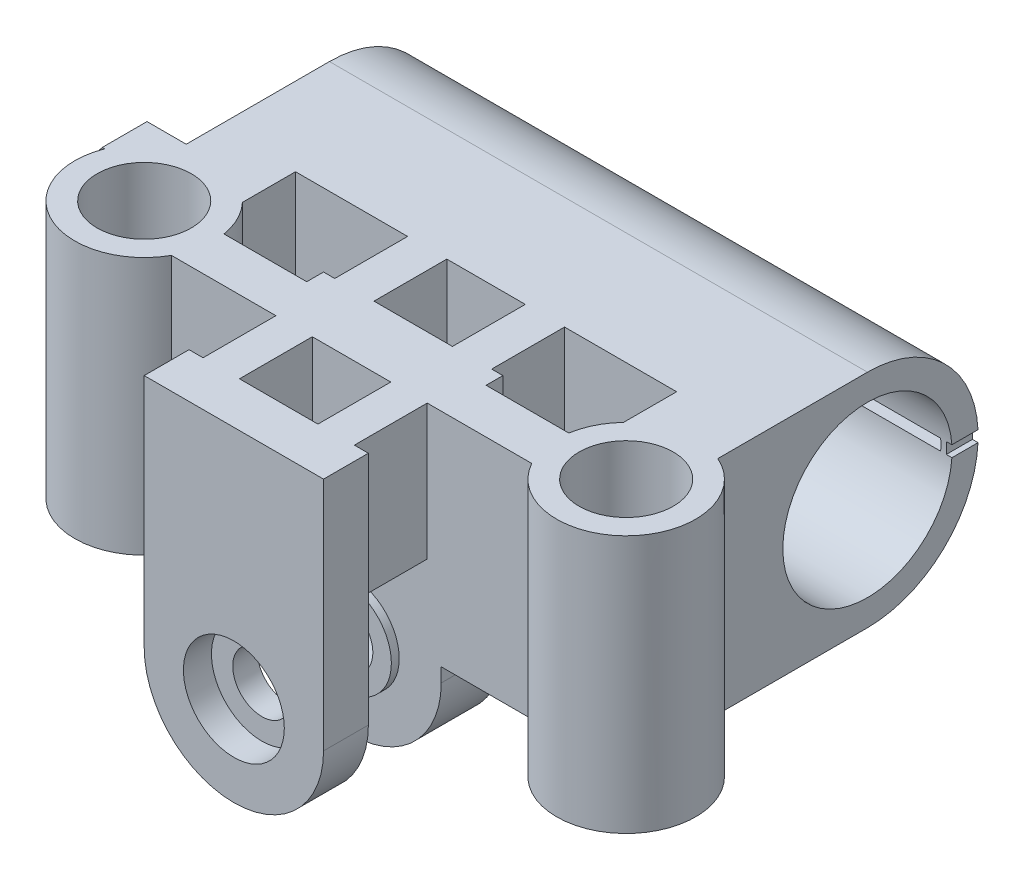
from build123d import *
from build123d.topology import SkipClean

# Parameters (mm, degrees)
BOSS_EXTRUDE1_DEPTH      = 19.75
FILLET1_RADIUS           = 9.875
FILLET1_LENGTH           = 48
SKETCH2_R                = 7.55
CUT_EXTRUDE1_DEPTH       = 70.718810231
BOSS_EXTRUDE2_START      = -23
SKETCH3_R                = 6.2
BOSS_EXTRUDE2_DEPTH      = 23
SKETCH4_R                = 4.2
CUT_EXTRUDE2_DEPTH       = 56.624185387
SKETCH5_W                = 7
SKETCH5_H                = 6.5
CUT_EXTRUDE3_DEPTH       = 56.624185387
BOSS_EXTRUDE3_DEPTH      = 4
CUT_EXTRUDE4_START       = -13.5
CUT_EXTRUDE4_OUTLINE_W   = 6.5
CUT_EXTRUDE4_OUTLINE_H   = 7.7
CUT_EXTRUDE4_DEPTH       = 13.5
BOSS_EXTRUDE4_DEPTH      = 5.5
SKETCH9_W                = 6.5
SKETCH9_H                = 7.7
CUT_EXTRUDE5_DEPTH       = 14
BOSS_EXTRUDE5_DEPTH      = 4
BOSS_EXTRUDE6_REACH      = 53.302
SKETCH11_R               = 4.25
CUT_EXTRUDE7_DEPTH       = 55.36094646
CUT_EXTRUDE7_DEPTH_BACK  = 5
SKETCH13_W               = 8.5
SKETCH13_H               = 5.1
CUT_EXTRUDE8_DEPTH       = 2.5
CUT_EXTRUDE6_REACH       = 56.361
SKETCH12_R               = 2.6
BOSS_EXTRUDE7_REACH      = 45.123
BOSS_EXTRUDE7_END_RADIUS = 9.875
SKETCH17_W               = 2.341574484
SKETCH17_H               = 1
CUT_EXTRUDE9_DEPTH       = 70.718810231
BOSS_EXTRUDE8_START      = -1
BOSS_EXTRUDE8_DEPTH      = 0.5
LPATTERN1_COUNT          = 7
LPATTERN1_PITCH          = 7.75
SKETCH19_R               = 4.5
CUT_EXTRUDE10_DEPTH      = 2.5
SKETCH20_W               = 4
SKETCH20_H               = 15.5
BOSS_EXTRUDE9_DEPTH      = 6.45
CUT_EXTRUDE11_REACH      = 44.782
SKETCH22_R               = 4.2
CUT_EXTRUDE12_DEPTH      = 60.71568052


# Read off the part's stored shape, not the designer's step: Cut-Extrude4
with BuildPart() as part:
    # Sketch1 → Boss-Extrude1 (new body)
    with BuildSketch(Plane(origin=(0, 0, 0), x_dir=(1, 0, 0), z_dir=(0, 1, 0))):
        with BuildLine():
            Line((16.074136013, -31.9), (6.75, -31.9))
            Line((6.75, -31.9), (6.75, -38.4))
            Line((6.75, -38.4), (8, -38.4))
            Line((8, -38.4), (8, -42.4))
            Line((8, -42.4), (-8, -42.4))
            Line((-8, -42.4), (-8, -38.4))
            Line((-8, -38.4), (-6.75, -38.4))
            Line((-6.75, -38.4), (-6.75, -31.9))
            Line((-6.75, -31.9), (-16.074136013, -31.9))
            ThreePointArc((-16.074136013, -31.9), (-26.076909961, -33.082331313), (-24, -23.226376819))
            Line((-24, -23.226376819), (-24, 0))
            Line((-24, 0), (24, 0))
            Line((24, 0), (24, -23.226376819))
            ThreePointArc((24, -23.226376819), (26.076909961, -33.082331313), (16.074136013, -31.9))
        make_face()
    extrude(amount=BOSS_EXTRUDE1_DEPTH)

    # Fillet1: full round fillet: the end face becomes a half cylinder, R = half its width
    fillet1_face = Plane((0, 9.875, 0), x_dir=(1, 0, 0), z_dir=(0, 0, -1))  # on the end face: x along it, z out of the body
    fillet1_slab = fillet1_face.offset(-FILLET1_RADIUS / 2) * Box(FILLET1_LENGTH, 2 * FILLET1_RADIUS, FILLET1_RADIUS, mode=Mode.PRIVATE)  # the body's end, R deep
    fillet1_round = Plane((0, 9.875, 9.875), x_dir=(0, 0, -1), z_dir=(1, 0, 0)) * Cylinder(FILLET1_RADIUS, FILLET1_LENGTH, mode=Mode.PRIVATE)  # its axis R under the face
    add(fillet1_slab - fillet1_round, mode=Mode.SUBTRACT)

    # Sketch2 → Cut-Extrude1 (cut, through all)
    with BuildSketch(Plane(origin=(24, 0, 0), x_dir=(0, 0, -1), z_dir=(1, 0, 0))):
        with Locations((-9.875, 9.875)):
            Circle(SKETCH2_R)
    extrude(amount=-CUT_EXTRUDE1_DEPTH, mode=Mode.SUBTRACT)

    # Sketch3 → Boss-Extrude2 (add)
    with SkipClean():  # the faces are left unmerged after this step: merging them gives an invalid solid
        with BuildSketch(Plane(origin=(0, 19.75, 0), x_dir=(1, 0, 0), z_dir=(0, 1, 0)).offset(BOSS_EXTRUDE2_START)):
            with Locations(Location((21.5, -28.9, 0), (0, 0, 66.220005269))):
                Circle(SKETCH3_R)
            with Locations(Location((-21.5, -28.9, 0), (0, 0, 113.779994731))):
                Circle(SKETCH3_R)
        extrude(amount=BOSS_EXTRUDE2_DEPTH)

    # Sketch4 → Cut-Extrude2 (cut, through all)
    with SkipClean():  # the faces are left unmerged after this step: merging them gives an invalid solid
        with BuildSketch(Plane(origin=(0, 19.75, 0), x_dir=(1, 0, 0), z_dir=(0, 1, 0))):
            with Locations(Location((-21.5, -28.9, 0), (0, 0, 270))):
                Circle(SKETCH4_R)
            with Locations(Location((21.5, -28.9, 0), (0, 0, 270))):
                Circle(SKETCH4_R)
        extrude(amount=-CUT_EXTRUDE2_DEPTH, mode=Mode.SUBTRACT)

    # Sketch5 → Cut-Extrude3 (cut, through all)
    with SkipClean():  # the faces are left unmerged after this step: merging them gives an invalid solid
        with BuildSketch(Plane(origin=(0, 19.75, 0), x_dir=(1, 0, 0), z_dir=(0, 1, 0))):
            with Locations((0, -23.15)):
                Rectangle(SKETCH5_W, SKETCH5_H)
            with Locations((0, -35.15)):
                Rectangle(SKETCH5_W, SKETCH5_H)
            with BuildLine():
                Line((17, -19.9), (7, -19.9))
                Line((7, -19.9), (7, -26.4))
                Line((7, -26.4), (8, -26.4))
                Line((8, -26.4), (8, -27.9))
                Line((8, -27.9), (15.381176584, -27.9))
                ThreePointArc((15.381176584, -27.9), (15.945284357, -26.145887779), (17, -24.635026378))
                Line((17, -24.635026378), (17, -19.9))
            make_face()
            with BuildLine():
                Line((-7, -19.9), (-17, -19.9))
                Line((-17, -19.9), (-17, -24.635026378))
                ThreePointArc((-17, -24.635026378), (-15.945284357, -26.145887779), (-15.381176584, -27.9))
                Line((-15.381176584, -27.9), (-8, -27.9))
                Line((-8, -27.9), (-8, -26.4))
                Line((-8, -26.4), (-7, -26.4))
                Line((-7, -26.4), (-7, -19.9))
            make_face()
        extrude(amount=-CUT_EXTRUDE3_DEPTH, mode=Mode.SUBTRACT)

    # Sketch6 → Boss-Extrude3 (add)
    with SkipClean():  # the faces are left unmerged after this step: merging them gives an invalid solid
        with BuildSketch(Plane.XY.offset(42.4)):
            with BuildLine():
                Line((-8, 0), (-8, -1.25))
                ThreePointArc((-8, -1.25), (0, -9.25), (8, -1.25))
                Line((8, -1.25), (8, 0))
                Line((8, 0), (-8, 0))
            make_face()
        extrude(amount=-BOSS_EXTRUDE3_DEPTH)

    # Cut-Extrude4 outline → Cut-Extrude4 (cut)
    with SkipClean():  # the faces are left unmerged after this step: merging them gives an invalid solid
        with BuildSketch(Plane(origin=(6.75, 0, 0), x_dir=(0, 0, -1), z_dir=(1, 0, 0)).offset(CUT_EXTRUDE4_START)):
            with Locations((-35.15, 3.85)):
                Rectangle(CUT_EXTRUDE4_OUTLINE_W, CUT_EXTRUDE4_OUTLINE_H)
        extrude(amount=CUT_EXTRUDE4_DEPTH, mode=Mode.SUBTRACT)
    add(part.part.scale(1), mode=Mode.REPLACE)  # the faces are merged on a copy

    # Sketch8 → Boss-Extrude4 (add)
    with BuildSketch(Plane.XY.offset(31.9)):
        with BuildLine():
            Line((-8, -1.25), (-8, 0))
            Line((-8, 0), (8, 0))
            Line((8, 0), (8, -1.25))
            ThreePointArc((8, -1.25), (0, -9.25), (-8, -1.25))
        make_face()
    extrude(amount=-BOSS_EXTRUDE4_DEPTH)

    # Sketch9 → Cut-Extrude5 (cut)
    with BuildSketch(Plane(origin=(7, 0, 0), x_dir=(0, 0, -1), z_dir=(1, 0, 0))):
        with Locations((-23.15, 3.85)):
            Rectangle(SKETCH9_W, SKETCH9_H)
    extrude(amount=-CUT_EXTRUDE5_DEPTH, mode=Mode.SUBTRACT)

    # Sketch10 → Boss-Extrude5 (add)
    with BuildSketch(Plane.XY.offset(19.9)):
        with BuildLine():
            Line((-8, -1.25), (-8, 0))
            Line((-8, 0), (8, 0))
            Line((8, 0), (8, -1.25))
            ThreePointArc((8, -1.25), (0, -9.25), (-8, -1.25))
        make_face()
    extrude(amount=-BOSS_EXTRUDE5_DEPTH)

    # Boss-Extrude6: up to this face of the body (flat: up to its plane)
    boss_extrude6_end = Plane(part.part.faces().sort_by_distance((0, 13.725, 19.9))[0])
    # Sketch11 → Boss-Extrude6 (add, up to the picked face)
    with BuildSketch(Plane(origin=(0, 0, 38.4), x_dir=(-1, 0, 0), z_dir=(0, 0, -1)), mode=Mode.PRIVATE) as boss_extrude6_sk1:
        with Locations(Location((0, -1.25, 0), (0, 0, 180))):
            Circle(SKETCH11_R)
    boss_extrude6_tool1 = split(extrude(boss_extrude6_sk1.sketch, amount=BOSS_EXTRUDE6_REACH, mode=Mode.PRIVATE), bisect_by=boss_extrude6_end, keep=Keep.BOTH, mode=Mode.PRIVATE)
    add(boss_extrude6_tool1.solids().sort_by(Axis((0, -1.25, 38.4), (0, 0, -1)))[0])

    # Sketch13 → Cut-Extrude7 (cut, two sides: drawn at the far end of the back side and taken through both)
    with BuildSketch(Plane.XZ.offset(-CUT_EXTRUDE7_DEPTH_BACK)):
        with Locations((0, 35.15)):
            Rectangle(SKETCH13_W, SKETCH13_H)
        with Locations((0, 23.15)):
            Rectangle(SKETCH13_W, SKETCH13_H)
    extrude(amount=CUT_EXTRUDE7_DEPTH + CUT_EXTRUDE7_DEPTH_BACK, mode=Mode.SUBTRACT)

    # Sketch15 → Cut-Extrude8 (cut, symmetric)
    with BuildSketch(Plane(origin=(0, 0, 0), x_dir=(0, 0, -1), z_dir=(1, 0, 0))):
        with BuildLine():
            Line((-15.9, 0), (-15.9, 2.050998466))
            ThreePointArc((-15.9, 2.050998466), (-13.05726412, 0.526801239), (-9.875, 0))
            Line((-9.875, 0), (-15.9, 0))
        make_face()
    extrude(amount=CUT_EXTRUDE8_DEPTH, both=True, mode=Mode.SUBTRACT)

    # Cut-Extrude6: up to this face of the body (flat: up to its plane)
    cut_extrude6_end = Plane(part.part.faces().sort_by_distance((0, -3.978206263, 15.9))[0])
    # Sketch12 → Cut-Extrude6 (cut, up to the picked face)
    with BuildSketch(Plane.XY.offset(42.4), mode=Mode.PRIVATE) as cut_extrude6_sk1:
        with Locations((0, -1.25)):
            Circle(SKETCH12_R)
    cut_extrude6_tool1 = split(extrude(cut_extrude6_sk1.sketch, amount=-CUT_EXTRUDE6_REACH, mode=Mode.PRIVATE), bisect_by=cut_extrude6_end, keep=Keep.BOTH, mode=Mode.PRIVATE)
    add(cut_extrude6_tool1.solids().sort_by(Axis((0, -1.25, 42.4), (0, 0, -1)))[0], mode=Mode.SUBTRACT)

    # Boss-Extrude7: up to this cylinder (the profile starts outside it)
    boss_extrude7_end = Plane(origin=(2.389901, 9.875, 9.875), z_dir=(1, 0, 0)) * Cylinder(BOSS_EXTRUDE7_END_RADIUS, 110.996, mode=Mode.PRIVATE)
    # Sketch16 → Boss-Extrude7 (add, up to the surface)
    with BuildSketch(Plane(origin=(0, 0, 15.9), x_dir=(-1, 0, 0), z_dir=(0, 0, -1)), mode=Mode.PRIVATE) as boss_extrude7_sk1:
        with BuildLine():
            Line((-2.279802623, 0), (-2.5, 0))
            Line((-2.5, 0), (-2.5, 1.800187721))
            Line((-2.5, 1.800187721), (2.5, 1.800187721))
            Line((2.5, 1.800187721), (2.5, 0))
            Line((2.5, 0), (2.279802623, 0))
            ThreePointArc((2.279802623, 0), (0, 1.35), (-2.279802623, 0))
        make_face()
    boss_extrude7_tool1 = extrude(boss_extrude7_sk1.sketch, amount=BOSS_EXTRUDE7_REACH, mode=Mode.PRIVATE) - boss_extrude7_end
    add(boss_extrude7_tool1.solids().sort_by_distance((2.389901, 0.053142, 15.9))[0])

    # Sketch17 → Cut-Extrude9 (cut, through all)
    with BuildSketch(Plane.ZY.offset(24)):
        with Locations((1.170787242, 9.875)):
            Rectangle(SKETCH17_W, SKETCH17_H)
    extrude(amount=-CUT_EXTRUDE9_DEPTH, mode=Mode.SUBTRACT)

    # Sketch18 → Boss-Extrude8 (add)
    with BuildSketch(Plane.ZY.offset(24).offset(BOSS_EXTRUDE8_START)):
        with BuildLine():
            Line((0.012666351, 10.375), (2.341574484, 10.375))
            ThreePointArc((2.341574484, 10.375), (2.325, 9.875), (2.341574484, 9.375))
            Line((2.341574484, 9.375), (0.012666351, 9.375))
            ThreePointArc((0.012666351, 9.375), (0, 9.875), (0.012666351, 10.375))
        make_face()
    boss_extrude8 = extrude(amount=BOSS_EXTRUDE8_DEPTH)

    # LPattern1: Boss-Extrude8 ×7
    with Locations(*[(i * LPATTERN1_PITCH, 0, 0) for i in range(1, LPATTERN1_COUNT)]):
        add(boss_extrude8)

    # Sketch19 → Cut-Extrude10 (cut)
    with BuildSketch(Plane.XY.offset(42.4)):
        with Locations((0, -1.25)):
            Circle(SKETCH19_R)
    extrude(amount=-CUT_EXTRUDE10_DEPTH, mode=Mode.SUBTRACT)

    # Sketch20 → Boss-Extrude9 (add)
    with BuildSketch(Plane.ZY.offset(24)):
        with Locations((24.65, 12)):
            Rectangle(SKETCH20_W, SKETCH20_H)
    extrude(amount=BOSS_EXTRUDE9_DEPTH)

    # Sketch21 → Cut-Extrude11 (cut, up to next)
    with BuildSketch(Plane(origin=(0, 0, 22.65), x_dir=(-1, 0, 0), z_dir=(0, 0, -1)), mode=Mode.PRIVATE) as cut_extrude11_sk1:
        Polygon((27.4983, 19.75), (30.45, 19.75), (30.45, 15.9032), align=None)
    cut_extrude11_tool1 = extrude(cut_extrude11_sk1.sketch, amount=-CUT_EXTRUDE11_REACH, mode=Mode.PRIVATE) & part.part
    add(cut_extrude11_tool1.solids().sort_by_distance((-29.4661, 18.467733, 22.65))[0], mode=Mode.SUBTRACT)

    # Sketch22 → Cut-Extrude12 (cut, through all)
    with BuildSketch(Plane(origin=(0, 19.75, 0), x_dir=(1, 0, 0), z_dir=(0, 1, 0))):
        with Locations(Location((-21.5, -28.9, 0), (0, 0, 270))):
            Circle(SKETCH22_R)
    extrude(amount=-CUT_EXTRUDE12_DEPTH, mode=Mode.SUBTRACT)


solid = part.part
